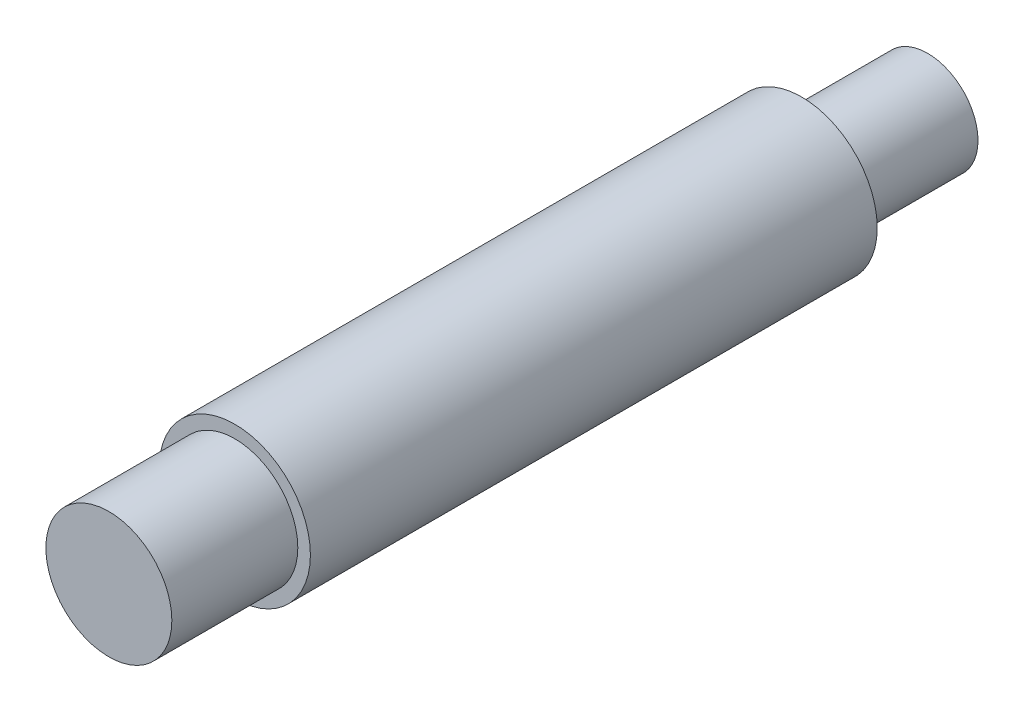
from build123d import *


with BuildPart() as part:
    # Sketch6 → Revolve1 (revolve)
    with BuildSketch(Plane(origin=(0, 0, 0), x_dir=(0, 0, -1), z_dir=(1, 0, 0))):
        Polygon((0, 0), (65, 0), (65, 4), (55, 4), (55, 6), (10, 6), (10, 5), (0, 5), align=None)
    revolve(axis=Axis((0, 0, 0), (0, 0, -1)))


solid = part.part
